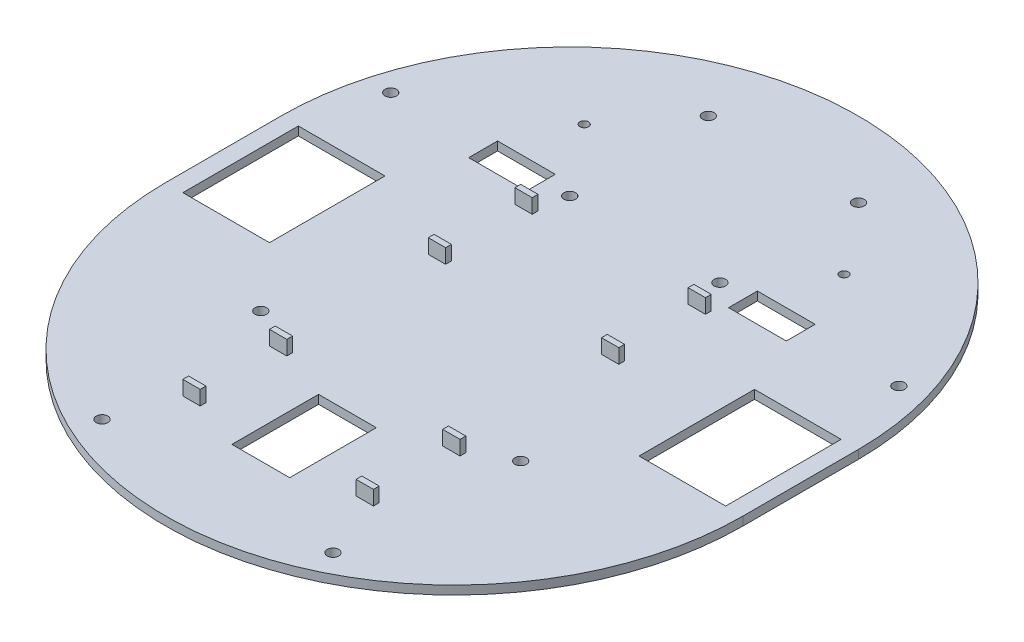
from build123d import *

# Parameters (mm, degrees)
SKETCH_1_R             = 100
SKETCH_1_W             = 200
SKETCH_1_H             = 40
EXTRUDE_461_DEPTH      = 3
SKETCH_3_W             = 30
SKETCH_3_H             = 40
SKETCH_3_W_2           = 20
SKETCH_3_H_2           = 10
SKETCH_3_H_3           = 30
CUT_EXTRUDE_1330_DEPTH = 3
SKETCH_2_R             = 2
SKETCH_2_R_2           = 1.5
CUT_EXTRUDE_2504_DEPTH = 173.072659072
SKETCH_6_W             = 6
SKETCH_6_H             = 2
EXTRUDE_3522_DEPTH     = 5


with BuildPart() as part:
    # 草图1 → Extrude 461 (new body)
    with BuildSketch(Plane(origin=(0, 0, 0), x_dir=(1, 0, 0), z_dir=(0, 1, 0))):
        Circle(SKETCH_1_R)
        with Locations((0, 40)):
            Circle(SKETCH_1_R)
        with Locations((0, 20)):
            Rectangle(SKETCH_1_W, SKETCH_1_H)
    extrude(amount=EXTRUDE_461_DEPTH)

    # 草图3 → Cut-Extrude 1330 (cut)
    with BuildSketch(Plane(origin=(0, 3, 0), x_dir=(1, 0, 0), z_dir=(0, 1, 0))):
        with Locations((-79, 20)):
            Rectangle(SKETCH_3_W, SKETCH_3_H)
        with Locations((79, 20)):
            Rectangle(SKETCH_3_W, SKETCH_3_H)
        with Locations((45, 65)):
            Rectangle(SKETCH_3_W_2, SKETCH_3_H_2)
        with Locations((0, -52)):
            Rectangle(SKETCH_3_W_2, SKETCH_3_H_3)
        with Locations((-45, 65)):
            Rectangle(SKETCH_3_W_2, SKETCH_3_H_2)
    extrude(amount=-CUT_EXTRUDE_1330_DEPTH, mode=Mode.SUBTRACT)

    # 草图2 → Cut-Extrude 2504 (cut, through all)
    with BuildSketch(Plane(origin=(0, 3, 0), x_dir=(1, 0, 0), z_dir=(0, 1, 0))):
        with Locations((-45, -22)):
            Circle(SKETCH_2_R)
        with Locations((-40, -82)):
            Circle(SKETCH_2_R)
        with Locations((-88, 66)):
            Circle(SKETCH_2_R)
        with Locations((-26, 66)):
            Circle(SKETCH_2_R)
        with Locations((-26, 114)):
            Circle(SKETCH_2_R)
        with Locations((40, -82)):
            Circle(SKETCH_2_R)
        with Locations((45, -22)):
            Circle(SKETCH_2_R)
        with Locations((26, 114)):
            Circle(SKETCH_2_R)
        with Locations((26, 66)):
            Circle(SKETCH_2_R)
        with Locations((88, 66)):
            Circle(SKETCH_2_R)
        with Locations((-45, 90)):
            Circle(SKETCH_2_R_2)
        with Locations((45, 90)):
            Circle(SKETCH_2_R_2)
    extrude(amount=-CUT_EXTRUDE_2504_DEPTH, mode=Mode.SUBTRACT)

    # 草图6 → Extrude 3522 (add)
    with BuildSketch(Plane(origin=(0, 3, 0), x_dir=(1, 0, 0), z_dir=(0, 1, 0))):
        with Locations((-30, -30)):
            Rectangle(SKETCH_6_W, SKETCH_6_H)
        with Locations((-30, -60)):
            Rectangle(SKETCH_6_W, SKETCH_6_H)
        with Locations((-30, 25)):
            Rectangle(SKETCH_6_W, SKETCH_6_H)
        with Locations((-30, 55)):
            Rectangle(SKETCH_6_W, SKETCH_6_H)
        with Locations((30, -60)):
            Rectangle(SKETCH_6_W, SKETCH_6_H)
        with Locations((30, -30)):
            Rectangle(SKETCH_6_W, SKETCH_6_H)
        with Locations((30, 55)):
            Rectangle(SKETCH_6_W, SKETCH_6_H)
        with Locations((30, 25)):
            Rectangle(SKETCH_6_W, SKETCH_6_H)
    extrude(amount=EXTRUDE_3522_DEPTH)


solid = part.part
